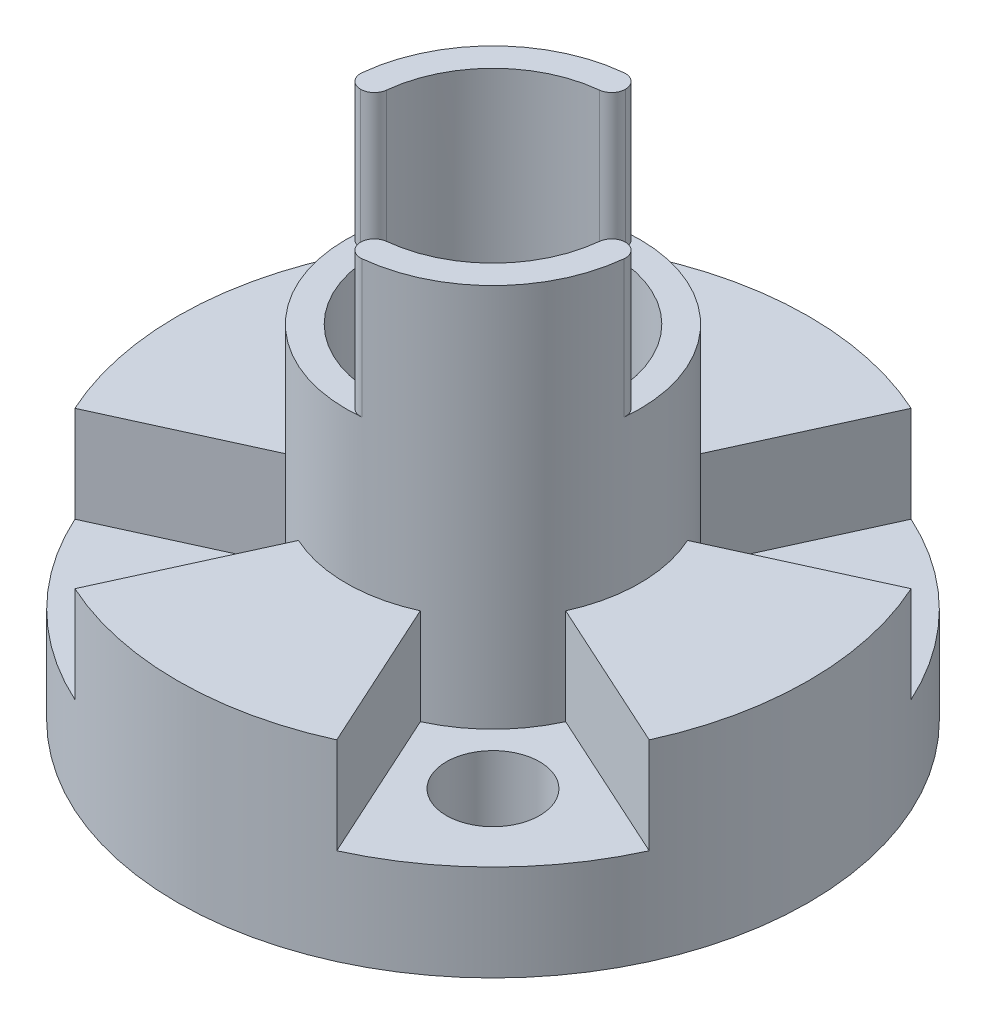
from build123d import *

# Parameters (mm, degrees)
CROQUIS1_R              = 11.5
CROQUIS1_R_2            = 4.35
CROQUIS1_R_3            = 1.7000000000000004
SALIENTE_EXTRUIR1_DEPTH = 3.5
CROQUIS2_R              = 5.35
CROQUIS2_R_2            = 4.35
SALIENTE_EXTRUIR2_DEPTH = 14
CORTAR_EXTRUIR1_START   = -5
CORTAR_EXTRUIR1_DEPTH   = 5
CROQUIS4_R              = 5.275
CROQUIS4_R_2            = 4.35
CORTAR_EXTRUIR2_DEPTH   = 2
REDONDEO1_R             = 0.6
REDONDEO2_R             = 0.5
SALIENTE_EXTRUIR3_DEPTH = 3.5


with BuildPart() as part:
    # Croquis1 → Saliente-Extruir1 (new body)
    with BuildSketch(Plane(origin=(0, 0, 0), x_dir=(1, 0, 0), z_dir=(0, 1, 0))):
        with Locations(Location((1.731948e-11, 0, 0), (0, 0, 270))):
            Circle(CROQUIS1_R)
        with Locations(Location((1.731948e-11, 0, 0), (0, 0, 270))):
            Circle(CROQUIS1_R_2, mode=Mode.SUBTRACT)
        with Locations(Location((5.656854249492441, 5.65685424949238, 0), (0, 0, 270))):
            Circle(CROQUIS1_R_3, mode=Mode.SUBTRACT)
        with Locations(Location((-5.656854249492318, 5.656854249492381, 0), (0, 0, 270))):
            Circle(CROQUIS1_R_3, mode=Mode.SUBTRACT)
        with Locations(Location((-5.656854249492318, -5.656854249492381, 0), (0, 0, 270))):
            Circle(CROQUIS1_R_3, mode=Mode.SUBTRACT)
        with Locations(Location((5.656854249492441, -5.65685424949238, 0), (0, 0, 270))):
            Circle(CROQUIS1_R_3, mode=Mode.SUBTRACT)
    extrude(amount=SALIENTE_EXTRUIR1_DEPTH)

    # Croquis2 → Saliente-Extruir2 (add)
    with BuildSketch(Plane(origin=(0, 3.5, 0), x_dir=(1, 0, 0), z_dir=(0, 1, 0))):
        with Locations(Location((1.731948e-11, 0, 0), (0, 0, 270))):
            Circle(CROQUIS2_R)
        with Locations(Location((1.731948e-11, 0, 0), (0, 0, 270))):
            Circle(CROQUIS2_R_2, mode=Mode.SUBTRACT)
    extrude(amount=SALIENTE_EXTRUIR2_DEPTH)

    # Croquis3 → Cortar-Extruir1 (cut)
    with BuildSketch(Plane(origin=(0, 17.5, 0), x_dir=(1, 0, 0), z_dir=(0, 1, 0)).offset(CORTAR_EXTRUIR1_START)):
        with BuildLine():
            Line((1.732086e-11, 5.35), (1.732072e-11, 4.35))
            ThreePointArc((1.732072e-11, 4.35), (3.0759144981543076, 3.0759144981369877), (4.34999999998268, 0))
            Line((4.34999999998268, 0), (5.34999999998268, 0))
            ThreePointArc((5.34999999998268, 0), (3.783021279340855, 3.783021279323535), (1.732086e-11, 5.35))
        make_face()
        with BuildLine():
            Line((1.732086e-11, -5.35), (1.732072e-11, -4.35))
            ThreePointArc((1.732072e-11, -4.35), (-3.075914498144163, -3.075914498161481), (-4.34999999998268, 0))
            Line((-4.34999999998268, 0), (-5.34999999998268, 0))
            ThreePointArc((-5.34999999998268, 0), (-3.7830212793307103, -3.7830212793480285), (1.732086e-11, -5.35))
        make_face()
    extrude(amount=CORTAR_EXTRUIR1_DEPTH, mode=Mode.SUBTRACT)

    # Croquis4 → Cortar-Extruir2 (cut)
    with BuildSketch(Plane.XZ):
        with Locations(Location((1.731948e-11, 0, 0), (0, 0, 270))):
            Circle(CROQUIS4_R)
        with Locations(Location((1.731948e-11, 0, 0), (0, 0, 270))):
            Circle(CROQUIS4_R_2, mode=Mode.SUBTRACT)
    extrude(amount=-CORTAR_EXTRUIR2_DEPTH, mode=Mode.SUBTRACT)

    # Redondeo1
    redondeo1_edges = [part.edges().sort_by_distance(p)[0] for p in [
        (1.732109e-11, 0, 5.275),
    ]]
    fillet(redondeo1_edges, radius=REDONDEO1_R)

    # Redondeo2
    # the kernel refuses this fillet: 0.5 mm, written as the material it takes off along each edge
    with BuildSketch(Plane(origin=(-4.34999999998268, 12.5, -2.1e-16), x_dir=(0.05161519234821224, 0, -0.9986670475783493), z_dir=(0, 1, 0))) as redondeo2_piece_1:
        with BuildLine():
            CenterArc((0.4748597696035476, 0.49933352378917434), REDONDEO2_R, 182.9586473758917, 84.08270524821648)
            Line((-0.02447375418562714, 0.4735259276150691), (0, 0))
            ThreePointArc((0, 0), (0.22452608671472166, 0.00579834303418057), (0.44905217342944187, 0))
        make_face()
    extrude(amount=6.185394894032285, mode=Mode.SUBTRACT)
    with BuildSketch(Plane(origin=(-5.34999999998268, 12.5, 0), x_dir=(1, 0, 0), z_dir=(0, 1, 0))) as redondeo2_piece_2:
        with BuildLine():
            CenterArc((0.5258420423870858, 0.5), REDONDEO2_R, 174.08270524821654, 95.91729475178346)
            ThreePointArc((0.02850617046822812, 0.5515463917525764), (0.00713129545583069, 0.27614127906293384), (0, 0))
            Line((0, 0), (0.5258420423870858, 0))
        make_face()
    extrude(amount=6.3807063953146645, mode=Mode.SUBTRACT)
    with BuildSketch(Plane(origin=(1.73185e-11, 12.5, 5.35), x_dir=(4.4e-15, 0, -1), z_dir=(0, 1, 0))) as redondeo2_piece_3:
        with BuildLine():
            CenterArc((0.5258420423870889, -0.5), REDONDEO2_R, 90.00000000000026, 95.91729475178363)
            ThreePointArc((0.02850617046823233, -0.5515463917525796), (0.0071312954558319, -0.27614127906293445), (0, 0))
            Line((0, 0), (0.5258420423870867, 0))
        make_face()
    extrude(amount=6.380706395314672, mode=Mode.SUBTRACT)
    with BuildSketch(Plane(origin=(1.731868e-11, 12.5, 4.35), x_dir=(0.9986670475783493, 0, -0.051615192348211894), z_dir=(0, 1, 0))) as redondeo2_piece_4:
        with BuildLine():
            CenterArc((0.474859769603551, -0.49933352378917434), REDONDEO2_R, 92.95864737589183, 84.08270524821639)
            Line((-0.0244737541856237, -0.4735259276150684), (0, 0))
            ThreePointArc((0, 0), (0.2245260867147224, -0.00579834303418053), (0.4490521734294448, 0))
        make_face()
    extrude(amount=6.185394894032285, mode=Mode.SUBTRACT)
    with BuildSketch(Plane(origin=(1.732072e-11, 12.5, -4.35), x_dir=(-0.9986670475783493, 0, 0.05161519234821218), z_dir=(0, 1, 0))) as redondeo2_piece_5:
        with BuildLine():
            CenterArc((0.474859769603548, -0.49933352378917434), REDONDEO2_R, 92.95864737589177, 84.08270524821641)
            Line((-0.02447375418562666, -0.47352592761506823), (0, 0))
            ThreePointArc((0, 0), (0.22452608671472019, -0.00579834303418048), (0.4490521734294423, 0))
        make_face()
    extrude(amount=6.185394894032285, mode=Mode.SUBTRACT)
    with BuildSketch(Plane(origin=(1.732103e-11, 12.5, -5.35), x_dir=(-4.2e-16, 0, 1), z_dir=(0, 1, 0))) as redondeo2_piece_6:
        with BuildLine():
            CenterArc((0.525842042387086, -0.5), REDONDEO2_R, 90.00000000000003, 95.91729475178352)
            ThreePointArc((0.02850617046822835, -0.5515463917525767), (0.00713129545583081, -0.27614127906293173), (0, 0))
            Line((0, 0), (0.5258420423870858, 0))
        make_face()
    extrude(amount=6.3807063953146645, mode=Mode.SUBTRACT)
    with BuildSketch(Plane(origin=(4.34999999998268, 12.5, 1.9e-16), x_dir=(-0.05161519227127975, 0, 0.9986670475823255), z_dir=(0, 1, 0))) as redondeo2_piece_7:
        with BuildLine():
            CenterArc((0.47485976964022647, 0.4993335237871862), REDONDEO2_R, 182.95864737147792, 84.08270524821648)
            Line((-0.02447375415093636, 0.4735259276515472), (0, 0))
            ThreePointArc((0, 0), (0.22452608671427532, 0.00579834305147695), (0.44905217342765447, 0))
        make_face()
    extrude(amount=6.1853948941188825, mode=Mode.SUBTRACT)
    with BuildSketch(Plane(origin=(5.34999999998268, 12.5, 0), x_dir=(-1, 0, 0), z_dir=(0, 1, 0))) as redondeo2_piece_8:
        with BuildLine():
            CenterArc((0.5258420423524468, 0.5), REDONDEO2_R, 174.08270524821646, 95.91729475178352)
            ThreePointArc((0.02850617043359005, 0.5515463917525769), (0.0071312954212388, 0.2761412790638265), (0, 0))
            Line((0, 0), (0.5258420423524468, 0))
        make_face()
    extrude(amount=6.380706395310195, mode=Mode.SUBTRACT)

    # Croquis5 → Saliente-Extruir3 (add)
    with BuildSketch(Plane(origin=(0, 3.5, 0), x_dir=(1, 0, 0), z_dir=(0, 1, 0))):
        with BuildLine():
            Line((-4.867801495370659, 2.219686599837588), (-10.46349854147086, 4.7712889529219185))
            ThreePointArc((-10.46349854147086, 4.7712889529219185), (-11.49999999998268, 1.41e-15), (-10.46349854147086, -4.771288952921916))
            Line((-10.46349854147086, -4.771288952921914), (-4.86780149537066, -2.219686599837586))
            ThreePointArc((-4.86780149537066, -2.219686599837586), (-5.34999999998268, 8.9e-16), (-4.86780149537066, 2.219686599837588))
        make_face()
        with BuildLine():
            Line((-2.2196865998351183, -4.867801495381207), (-4.77128895293652, -10.463498541473625))
            ThreePointArc((-4.771288952936522, -10.463498541473623), (-6.77758e-12, -11.5), (4.771288952927311, -10.463498541493617))
            Line((4.771288952927309, -10.46349854149362), (2.2196865998493576, -4.86780149539051))
            ThreePointArc((2.219686599849358, -4.867801495390509), (6.10956e-12, -5.35), (-2.219686599835118, -4.867801495381206))
        make_face()
        with BuildLine():
            ThreePointArc((11.50000000001732, 0), (11.237887551221265, 2.4412872396535783), (10.463498541496383, 4.771288952941911))
            Line((10.463498541496381, 4.7712889529419105), (4.867801495401058, 2.2196865998468893))
            ThreePointArc((4.867801495401059, 2.2196865998468898), (5.228060730360026, 1.1357292810562294), (5.350000000017321, -1.1e-16))
            ThreePointArc((5.350000000017321, -1.1e-16), (5.228060730360026, -1.1357292810562303), (4.867801495401057, -2.2196865998468898))
            Line((4.867801495401058, -2.2196865998468898), (10.463498541496381, -4.771288952941912))
            ThreePointArc((10.463498541496378, -4.7712889529419185), (11.237887551221265, -2.4412872396535787), (11.50000000001732, -2.82e-15))
        make_face()
        with BuildLine():
            ThreePointArc((4.771288952927309, 10.46349854149362), (-6.77732e-12, 11.5), (-4.771288952936519, 10.463498541473625))
            Line((-4.771288952936519, 10.463498541473623), (-2.2196865998351187, 4.867801495381207))
            ThreePointArc((-2.219686599835118, 4.867801495381207), (6.10867e-12, 5.35), (2.219686599849357, 4.86780149539051))
            Line((2.2196865998493576, 4.86780149539051), (4.771288952927309, 10.46349854149362))
        make_face()
    extrude(amount=SALIENTE_EXTRUIR3_DEPTH)


solid = part.part
